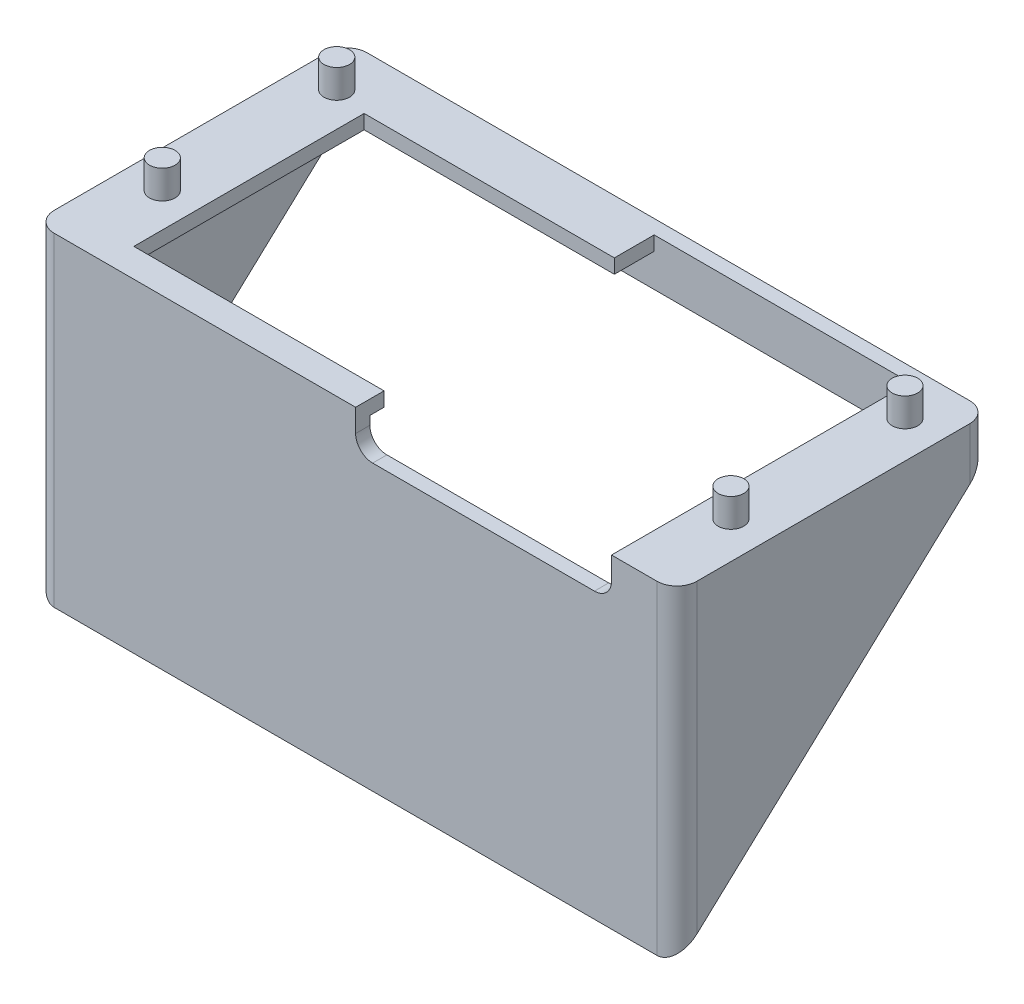
from build123d import *

# Parameters (mm, degrees)
SKETCH1_W           = 113
SKETCH1_H           = 55
BOSS_EXTRUDE1_DEPTH = 6
BOSS_EXTRUDE3_DEPTH = 113
SKETCH2_R           = 2.25
BOSS_EXTRUDE2_DEPTH = 5
SHELL1_START        = -50.038745387
SHELL1_DEPTH        = 108
SKETCH4_W           = 44
SKETCH4_H           = 7
SKETCH4_W_2         = 88
SKETCH4_H_2         = 40.5
CUT_EXTRUDE1_DEPTH  = 10
FILLET2_R           = 3.5
CUT_EXTRUDE2_START  = -52.5
SKETCH5_W           = 45
SKETCH5_H           = 7
CUT_EXTRUDE2_DEPTH  = 52.5
FILLET3_R           = 3


# Read off the part's stored shape, not the designer's step: Shell1
with BuildPart() as part:
    # Sketch1 → Boss-Extrude1 (new body)
    with BuildSketch(Plane(origin=(0, 0, 0), x_dir=(1, 0, 0), z_dir=(0, 1, 0))):
        with Locations((3.961254613, 12.529520295)):
            Rectangle(SKETCH1_W, SKETCH1_H)
    extrude(amount=BOSS_EXTRUDE1_DEPTH)

    # Sketch3 → Boss-Extrude3 (add)
    with BuildSketch(Plane(origin=(60.461254613, 0, 0), x_dir=(0, 0, -1), z_dir=(1, 0, 0))):
        Polygon((-14.970479705, 0), (-14.970479705, -50.990195136), (40.029520295, 0), align=None)
    extrude(amount=-BOSS_EXTRUDE3_DEPTH)

    # Sketch2 → Boss-Extrude2 (add)
    with BuildSketch(Plane(origin=(0, 6, 0), x_dir=(1, 0, 0), z_dir=(0, 1, 0))):
        with Locations(Location((-46.038745387, 31.709520295, 0), (0, 0, 270))):
            Circle(SKETCH2_R)
        with Locations(Location((53.961254613, 31.629520295, 0), (0, 0, 270))):
            Circle(SKETCH2_R)
        with Locations(Location((53.961254613, 1.029520295, 0), (0, 0, 270))):
            Circle(SKETCH2_R)
        with Locations(Location((-46.038745387, 1.029520295, 0), (0, 0, 270))):
            Circle(SKETCH2_R)
    extrude(amount=BOSS_EXTRUDE2_DEPTH)

    # Shell1 outline → Shell1 (cut)
    with BuildSketch(Plane.YZ.offset(SHELL1_START)):
        Polygon((3.5, 12.470479705), (-48.672458993, 12.470479705), (-2.317736143, -37.529520295), (3.5, -37.529520295), align=None)
    extrude(amount=SHELL1_DEPTH, mode=Mode.SUBTRACT)

    # Sketch4 → Cut-Extrude1 (cut)
    with BuildSketch(Plane.XZ.offset(-3.5)):
        with Locations((25.961254613, -34.029520295)):
            Rectangle(SKETCH4_W, SKETCH4_H)
        with Locations((3.961254613, -10.279520295)):
            Rectangle(SKETCH4_W_2, SKETCH4_H_2)
    extrude(amount=-CUT_EXTRUDE1_DEPTH, mode=Mode.SUBTRACT)

    # Fillet2
    fillet2_edges = [part.edges().sort_by_distance(p)[0] for p in [
        (-52.538745387, 3, -40.029520295),
        (60.461254613, 3, -40.029520295),
        (60.461254613, -22.495097568, 14.970479705),
        (-52.538745387, -22.495097568, 14.970479705),
    ]]
    fillet(fillet2_edges, radius=FILLET2_R)

    # Sketch5 → Cut-Extrude2 (cut)
    with BuildSketch(Plane.XY.offset(14.970479705).offset(CUT_EXTRUDE2_START)):
        with Locations((26.461254613, 2.5)):
            Rectangle(SKETCH5_W, SKETCH5_H)
    extrude(amount=CUT_EXTRUDE2_DEPTH, mode=Mode.SUBTRACT)

    # Fillet3
    fillet3_edges = [part.edges().sort_by_distance(p)[0] for p in [
        (3.961254613, -1, 13.720479705),
        (48.961254613, -1, 13.720479705),
    ]]
    fillet(fillet3_edges, radius=FILLET3_R)


solid = part.part
